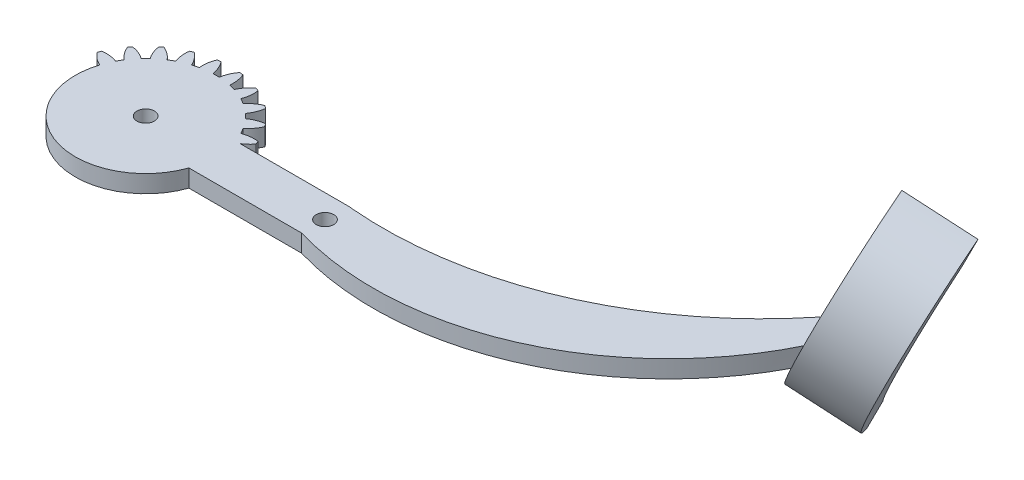
from build123d import *
from build123d.topology import SkipClean

# Parameters (mm, degrees)
SKETCH1_R           = 1.5
BOSS_EXTRUDE1_DEPTH = 3
CUT_EXTRUDE1_START  = -10
CUT_EXTRUDE1_DEPTH  = 10
BOSS_EXTRUDE2_DEPTH = 3
BOSS_EXTRUDE3_START = -25
BOSS_EXTRUDE3_DEPTH = 11
CUT_EXTRUDE2_DEPTH  = 18


with BuildPart() as part:
    # Sketch1 → Boss-Extrude1 (new body)
    with BuildSketch(Plane(origin=(0, 0, 0), x_dir=(1, 0, 0), z_dir=(0, 1, 0))):
        with BuildLine():
            Line((20.643657446, 4), (2.081641936, 4))
            ThreePointArc((2.081641936, 4), (2.861028333, 4.588201733), (3.521749436, 5.30713988))
            ThreePointArc((3.521749436, 5.30713988), (3.405395609, 5.596745198), (3.282888305, 5.883801663))
            ThreePointArc((3.282888305, 5.883801663), (1.93527598, 5.894040025), (0.627094961, 5.57027124))
            ThreePointArc((0.627094961, 5.57027124), (0.366286148, 6.046375), (0.084372603, 6.510293938))
            ThreePointArc((0.084372603, 6.510293938), (1.018855105, 7.48132754), (1.683794586, 8.65351323))
            ThreePointArc((1.683794586, 8.65351323), (1.496450048, 8.903135899), (1.303821399, 9.148703928))
            ThreePointArc((1.303821399, 9.148703928), (-0.000522033, 8.809805691), (-1.180330337, 8.158486898))
            ThreePointArc((-1.180330337, 8.158486898), (-1.555477026, 8.550865528), (-1.947855656, 8.926012217))
            ThreePointArc((-1.947855656, 8.926012217), (-1.296536862, 10.105820521), (-0.957638625, 11.410163953))
            ThreePointArc((-0.957638625, 11.410163953), (-1.203206655, 11.602792602), (-1.452829324, 11.79013714))
            ThreePointArc((-1.452829324, 11.79013714), (-2.625015014, 11.125197659), (-3.596048616, 10.190715157))
            ThreePointArc((-3.596048616, 10.190715157), (-4.059967554, 10.472628702), (-4.536071314, 10.733437515))
            ThreePointArc((-4.536071314, 10.733437515), (-4.212302529, 12.041618533), (-4.222540891, 13.389230859))
            ThreePointArc((-4.222540891, 13.389230859), (-4.509597355, 13.511738163), (-4.799202674, 13.62809199))
            ThreePointArc((-4.799202674, 13.62809199), (-5.759348103, 12.682425791), (-6.455432668, 11.528463019))
            ThreePointArc((-6.455432668, 11.528463019), (-6.976508546, 11.680699536), (-7.503891752, 11.809396783))
            ThreePointArc((-7.503891752, 11.809396783), (-7.529737283, 13.156800143), (-7.888414517, 14.455843809))
            ThreePointArc((-7.888414517, 14.455843809), (-8.197396993, 14.499881098), (-8.507248835, 14.537314892))
            ThreePointArc((-8.507248835, 14.537314892), (-9.18992168, 13.375367565), (-9.563620196, 12.080565177))
            ThreePointArc((-9.563620196, 12.080565177), (-10.106342554, 12.09275), (-10.649064912, 12.080565177))
            ThreePointArc((-10.649064912, 12.080565177), (-11.022763428, 13.375367565), (-11.705436272, 14.537314892))
            ThreePointArc((-11.705436272, 14.537314892), (-12.015288115, 14.499881098), (-12.324270591, 14.455843809))
            ThreePointArc((-12.324270591, 14.455843809), (-12.682947825, 13.156800143), (-12.708793355, 11.809396783))
            ThreePointArc((-12.708793355, 11.809396783), (-13.236176561, 11.680699536), (-13.757252439, 11.528463019))
            ThreePointArc((-13.757252439, 11.528463019), (-14.453337005, 12.682425791), (-15.413482434, 13.62809199))
            ThreePointArc((-15.413482434, 13.62809199), (-15.703087752, 13.511738163), (-15.990144217, 13.389230859))
            ThreePointArc((-15.990144217, 13.389230859), (-16.000382579, 12.041618533), (-15.676613793, 10.733437515))
            ThreePointArc((-15.676613793, 10.733437515), (-16.152717554, 10.472628702), (-16.616636492, 10.190715157))
            ThreePointArc((-16.616636492, 10.190715157), (-17.587670094, 11.125197659), (-18.759855783, 11.79013714))
            ThreePointArc((-18.759855783, 11.79013714), (-19.009478453, 11.602792602), (-19.255046482, 11.410163953))
            ThreePointArc((-19.255046482, 11.410163953), (-18.916148245, 10.105820521), (-18.264829452, 8.926012217))
            ThreePointArc((-18.264829452, 8.926012217), (-18.657208082, 8.550865528), (-19.032354771, 8.158486898))
            ThreePointArc((-19.032354771, 8.158486898), (-20.212163074, 8.809805691), (-21.516506507, 9.148703928))
            ThreePointArc((-21.516506507, 9.148703928), (-21.709135156, 8.903135899), (-21.896479694, 8.65351323))
            ThreePointArc((-21.896479694, 8.65351323), (-21.231540213, 7.48132754), (-20.297057711, 6.510293938))
            ThreePointArc((-20.297057711, 6.510293938), (-20.578971255, 6.046375), (-20.839780068, 5.57027124))
            ThreePointArc((-20.839780068, 5.57027124), (-22.147961087, 5.894040025), (-23.495573413, 5.883801663))
            ThreePointArc((-23.495573413, 5.883801663), (-23.618080717, 5.596745198), (-23.734434544, 5.30713988))
            ThreePointArc((-23.734434544, 5.30713988), (-22.788768345, 4.346994451), (-21.634805572, 3.650909885))
            ThreePointArc((-21.634805572, 3.650909885), (-21.78704209, 3.129834008), (-21.915739337, 2.602450802))
            ThreePointArc((-21.915739337, 2.602450802), (-23.263142697, 2.576605271), (-24.562186363, 2.217928037))
            ThreePointArc((-24.562186363, 2.217928037), (-24.606223651, 1.908945561), (-24.643657446, 1.599093719))
            ThreePointArc((-24.643657446, 1.599093719), (-23.481710119, 0.916420874), (-22.186907731, 0.542722358))
            ThreePointArc((-22.186907731, 0.542722358), (-22.199092554, 0), (-22.186907731, -0.542722358))
            ThreePointArc((-22.186907731, -0.542722358), (-23.481710119, -0.916420874), (-24.643657446, -1.599093719))
            ThreePointArc((-24.643657446, -1.599093719), (-24.606223651, -1.908945561), (-24.562186363, -2.217928037))
            ThreePointArc((-24.562186363, -2.217928037), (-23.263142697, -2.576605271), (-21.915739337, -2.602450802))
            ThreePointArc((-21.915739337, -2.602450802), (-21.78704209, -3.129834008), (-21.634805572, -3.650909885))
            ThreePointArc((-21.634805572, -3.650909885), (-22.788768345, -4.346994451), (-23.734434544, -5.30713988))
            ThreePointArc((-23.734434544, -5.30713988), (-23.618080717, -5.596745198), (-23.495573413, -5.883801663))
            ThreePointArc((-23.495573413, -5.883801663), (-22.147961087, -5.894040025), (-20.839780068, -5.57027124))
            ThreePointArc((-20.839780068, -5.57027124), (-20.578971255, -6.046375), (-20.297057711, -6.510293938))
            ThreePointArc((-20.297057711, -6.510293938), (-21.231540213, -7.48132754), (-21.896479694, -8.65351323))
            ThreePointArc((-21.896479694, -8.65351323), (-21.709135156, -8.903135899), (-21.516506507, -9.148703928))
            ThreePointArc((-21.516506507, -9.148703928), (-20.212163074, -8.809805691), (-19.032354771, -8.158486898))
            ThreePointArc((-19.032354771, -8.158486898), (-18.657208082, -8.550865528), (-18.264829452, -8.926012217))
            ThreePointArc((-18.264829452, -8.926012217), (-18.916148245, -10.105820521), (-19.255046482, -11.410163953))
            ThreePointArc((-19.255046482, -11.410163953), (-19.009478453, -11.602792602), (-18.759855783, -11.79013714))
            ThreePointArc((-18.759855783, -11.79013714), (-17.587670094, -11.125197659), (-16.616636492, -10.190715157))
            ThreePointArc((-16.616636492, -10.190715157), (-16.152717554, -10.472628702), (-15.676613793, -10.733437515))
            ThreePointArc((-15.676613793, -10.733437515), (-16.000382579, -12.041618533), (-15.990144217, -13.389230859))
            ThreePointArc((-15.990144217, -13.389230859), (-15.703087752, -13.511738163), (-15.413482434, -13.62809199))
            ThreePointArc((-15.413482434, -13.62809199), (-14.453337005, -12.682425791), (-13.757252439, -11.528463019))
            ThreePointArc((-13.757252439, -11.528463019), (-13.236176561, -11.680699536), (-12.708793355, -11.809396783))
            ThreePointArc((-12.708793355, -11.809396783), (-12.682947825, -13.156800143), (-12.324270591, -14.455843809))
            ThreePointArc((-12.324270591, -14.455843809), (-12.015288115, -14.499881098), (-11.705436272, -14.537314892))
            ThreePointArc((-11.705436272, -14.537314892), (-11.022763428, -13.375367565), (-10.649064912, -12.080565177))
            ThreePointArc((-10.649064912, -12.080565177), (-10.106342554, -12.09275), (-9.563620196, -12.080565177))
            ThreePointArc((-9.563620196, -12.080565177), (-9.18992168, -13.375367565), (-8.507248835, -14.537314892))
            ThreePointArc((-8.507248835, -14.537314892), (-8.197396993, -14.499881098), (-7.888414517, -14.455843809))
            ThreePointArc((-7.888414517, -14.455843809), (-7.529737283, -13.156800143), (-7.503891752, -11.809396783))
            ThreePointArc((-7.503891752, -11.809396783), (-6.976508546, -11.680699536), (-6.455432668, -11.528463019))
            ThreePointArc((-6.455432668, -11.528463019), (-5.759348103, -12.682425791), (-4.799202674, -13.62809199))
            ThreePointArc((-4.799202674, -13.62809199), (-4.509597355, -13.511738163), (-4.222540891, -13.389230859))
            ThreePointArc((-4.222540891, -13.389230859), (-4.212302529, -12.041618533), (-4.536071314, -10.733437515))
            ThreePointArc((-4.536071314, -10.733437515), (-4.059967554, -10.472628702), (-3.596048616, -10.190715157))
            ThreePointArc((-3.596048616, -10.190715157), (-2.625015014, -11.125197659), (-1.452829324, -11.79013714))
            ThreePointArc((-1.452829324, -11.79013714), (-1.203206655, -11.602792602), (-0.957638625, -11.410163953))
            ThreePointArc((-0.957638625, -11.410163953), (-1.296536862, -10.105820521), (-1.947855656, -8.926012217))
            ThreePointArc((-1.947855656, -8.926012217), (-1.555477026, -8.550865528), (-1.180330337, -8.158486898))
            ThreePointArc((-1.180330337, -8.158486898), (-0.000522033, -8.809805691), (1.303821399, -9.148703928))
            ThreePointArc((1.303821399, -9.148703928), (1.496450048, -8.903135899), (1.683794586, -8.65351323))
            ThreePointArc((1.683794586, -8.65351323), (1.018855105, -7.48132754), (0.084372603, -6.510293938))
            ThreePointArc((0.084372603, -6.510293938), (0.366286148, -6.046375), (0.627094961, -5.57027124))
            ThreePointArc((0.627094961, -5.57027124), (1.93527598, -5.894040025), (3.282888305, -5.883801663))
            ThreePointArc((3.282888305, -5.883801663), (3.405395609, -5.596745198), (3.521749436, -5.30713988))
            ThreePointArc((3.521749436, -5.30713988), (2.861028333, -4.588201733), (2.081641936, -4))
            Line((2.081641936, -4), (20.643657446, -4))
            ThreePointArc((20.643657446, -4), (24.643657446, 0), (20.643657446, 4))
        make_face()
        with Locations((-10.106342554, 0)):
            Circle(SKETCH1_R, mode=Mode.SUBTRACT)
        with Locations((20.643657446, 0)):
            Circle(SKETCH1_R, mode=Mode.SUBTRACT)
    extrude(amount=BOSS_EXTRUDE1_DEPTH)

    # Sketch2 → Cut-Extrude1 (cut)
    with SkipClean():  # the faces are left unmerged after this step: merging them gives an invalid solid
        with BuildSketch(Plane(origin=(0, 3, 0), x_dir=(1, 0, 0), z_dir=(0, 1, 0)).offset(CUT_EXTRUDE1_START)):
            with BuildLine():
                ThreePointArc((3.521749436, -5.30713988), (2.861028333, -4.588201733), (2.081641936, -4))
                Line((2.081641936, -4), (1.305695063, -4))
                ThreePointArc((1.305695063, -4), (0.994195953, -4.797149927), (0.627094961, -5.57027124))
                ThreePointArc((0.627094961, -5.57027124), (1.93527598, -5.894040025), (3.282888305, -5.883801663))
                ThreePointArc((3.282888305, -5.883801663), (3.405395609, -5.596745198), (3.521749436, -5.30713988))
            make_face()
            with BuildLine():
                ThreePointArc((1.683794586, -8.65351323), (1.018855105, -7.48132754), (0.084372603, -6.510293938))
                ThreePointArc((0.084372603, -6.510293938), (-0.512518948, -7.361599771), (-1.180330337, -8.158486898))
                ThreePointArc((-1.180330337, -8.158486898), (-0.000522033, -8.809805691), (1.303821399, -9.148703928))
                ThreePointArc((1.303821399, -9.148703928), (1.496450048, -8.903135899), (1.683794586, -8.65351323))
            make_face()
            with BuildLine():
                ThreePointArc((-0.957638625, -11.410163953), (-1.296536862, -10.105820521), (-1.947855656, -8.926012217))
                ThreePointArc((-1.947855656, -8.926012217), (-2.744742783, -9.593823606), (-3.596048616, -10.190715157))
                ThreePointArc((-3.596048616, -10.190715157), (-2.625015014, -11.125197659), (-1.452829324, -11.79013714))
                ThreePointArc((-1.452829324, -11.79013714), (-1.203206655, -11.602792602), (-0.957638625, -11.410163953))
            make_face()
            with BuildLine():
                ThreePointArc((-4.222540891, -13.389230859), (-4.212302529, -12.041618533), (-4.536071314, -10.733437515))
                ThreePointArc((-4.536071314, -10.733437515), (-5.478647477, -11.172244217), (-6.455432668, -11.528463019))
                ThreePointArc((-6.455432668, -11.528463019), (-5.759348103, -12.682425791), (-4.799202674, -13.62809199))
                ThreePointArc((-4.799202674, -13.62809199), (-4.509597355, -13.511738163), (-4.222540891, -13.389230859))
            make_face()
            with BuildLine():
                ThreePointArc((-7.888414517, -14.455843809), (-7.529737283, -13.156800143), (-7.503891752, -11.809396783))
                ThreePointArc((-7.503891752, -11.809396783), (-8.527921943, -11.989294847), (-9.563620196, -12.080565177))
                ThreePointArc((-9.563620196, -12.080565177), (-9.18992168, -13.375367565), (-8.507248835, -14.537314892))
                ThreePointArc((-8.507248835, -14.537314892), (-8.197396993, -14.499881098), (-7.888414517, -14.455843809))
            make_face()
            with BuildLine():
                ThreePointArc((-11.705436272, -14.537314892), (-11.022763428, -13.375367565), (-10.649064912, -12.080565177))
                ThreePointArc((-10.649064912, -12.080565177), (-11.684763165, -11.989294847), (-12.708793355, -11.809396783))
                ThreePointArc((-12.708793355, -11.809396783), (-12.682947825, -13.156800143), (-12.324270591, -14.455843809))
                ThreePointArc((-12.324270591, -14.455843809), (-12.015288115, -14.499881098), (-11.705436272, -14.537314892))
            make_face()
            with BuildLine():
                ThreePointArc((-15.413482434, -13.62809199), (-14.453337005, -12.682425791), (-13.757252439, -11.528463019))
                ThreePointArc((-13.757252439, -11.528463019), (-14.734037631, -11.172244217), (-15.676613793, -10.733437515))
                ThreePointArc((-15.676613793, -10.733437515), (-16.000382579, -12.041618533), (-15.990144217, -13.389230859))
                ThreePointArc((-15.990144217, -13.389230859), (-15.703087752, -13.511738163), (-15.413482434, -13.62809199))
            make_face()
            with BuildLine():
                ThreePointArc((-18.759855783, -11.79013714), (-17.587670094, -11.125197659), (-16.616636492, -10.190715157))
                ThreePointArc((-16.616636492, -10.190715157), (-17.467942324, -9.593823606), (-18.264829452, -8.926012217))
                ThreePointArc((-18.264829452, -8.926012217), (-18.916148245, -10.105820521), (-19.255046482, -11.410163953))
                ThreePointArc((-19.255046482, -11.410163953), (-19.009478453, -11.602792602), (-18.759855783, -11.79013714))
            make_face()
            with BuildLine():
                ThreePointArc((-21.516506507, -9.148703928), (-20.212163074, -8.809805691), (-19.032354771, -8.158486898))
                ThreePointArc((-19.032354771, -8.158486898), (-19.70016616, -7.361599771), (-20.297057711, -6.510293938))
                ThreePointArc((-20.297057711, -6.510293938), (-21.231540213, -7.48132754), (-21.896479694, -8.65351323))
                ThreePointArc((-21.896479694, -8.65351323), (-21.709135156, -8.903135899), (-21.516506507, -9.148703928))
            make_face()
            with BuildLine():
                ThreePointArc((-23.495573413, -5.883801663), (-22.147961087, -5.894040025), (-20.839780068, -5.57027124))
                ThreePointArc((-20.839780068, -5.57027124), (-21.278586771, -4.627695077), (-21.634805572, -3.650909885))
                ThreePointArc((-21.634805572, -3.650909885), (-22.788768345, -4.346994451), (-23.734434544, -5.30713988))
                ThreePointArc((-23.734434544, -5.30713988), (-23.618080717, -5.596745198), (-23.495573413, -5.883801663))
            make_face()
            with BuildLine():
                ThreePointArc((-24.562186363, -2.217928037), (-23.263142697, -2.576605271), (-21.915739337, -2.602450802))
                ThreePointArc((-21.915739337, -2.602450802), (-22.095637401, -1.578420611), (-22.186907731, -0.542722358))
                ThreePointArc((-22.186907731, -0.542722358), (-23.481710119, -0.916420874), (-24.643657446, -1.599093719))
                ThreePointArc((-24.643657446, -1.599093719), (-24.606223651, -1.908945561), (-24.562186363, -2.217928037))
            make_face()
            with BuildLine():
                ThreePointArc((-22.186907731, 0.542722358), (-22.095637401, 1.578420611), (-21.915739337, 2.602450802))
                ThreePointArc((-21.915739337, 2.602450802), (-23.263142697, 2.576605271), (-24.562186363, 2.217928037))
                ThreePointArc((-24.562186363, 2.217928037), (-24.606223651, 1.908945561), (-24.643657446, 1.599093719))
                ThreePointArc((-24.643657446, 1.599093719), (-23.481710119, 0.916420874), (-22.186907731, 0.542722358))
            make_face()
        extrude(amount=CUT_EXTRUDE1_DEPTH, mode=Mode.SUBTRACT)

    # Sketch3 → Boss-Extrude2 (add)
    with SkipClean():  # the faces are left unmerged after this step: merging them gives an invalid solid
        with BuildSketch(Plane(origin=(0, 0, 0), x_dir=(-1, 0, 0), z_dir=(0, -1, 0))):
            with BuildLine():
                Line((-79.256129558, 30.184422326), (-84.5347622, 34.134758187))
                ThreePointArc((-84.5347622, 34.134758187), (-60.921194782, 1.107942896), (-20.643657446, -4))
                ThreePointArc((-20.643657446, -4), (-24.627079637, -0.363796164), (-21.368234303, 3.933826175))
                ThreePointArc((-21.368234303, 3.933826175), (-53.742117956, 9.495418793), (-79.256129558, 30.184422326))
            make_face()
        extrude(amount=-BOSS_EXTRUDE2_DEPTH)

    # Sketch6 → Boss-Extrude3 (add)
    with SkipClean():  # the faces are left unmerged after this step: merging them gives an invalid solid
        with BuildSketch(Plane(origin=(83.697305175, -41.228426748, -34.520544843), x_dir=(-0.31128571654952064, 0.15333612397060284, -0.9378641883332167), z_dir=(0.8413302222587926, -0.41443056459664523, -0.34700254212624526)).offset(BOSS_EXTRUDE3_START)):
            with BuildLine():
                Line((5.839272949, 55.835320297), (6.70860934, 60.75916577))
                ThreePointArc((6.70860934, 60.75916577), (-7.758054939, 45.542684524), (0.623254605, 26.29224746))
                Line((0.623254605, 26.29224746), (1.492590996, 31.216092933))
                ThreePointArc((1.492590996, 31.216092933), (-1.305346039, 44.403417523), (5.839272949, 55.835320297))
            make_face()
        extrude(amount=BOSS_EXTRUDE3_DEPTH)

    # Sketch7 → Cut-Extrude2 (cut)
    with SkipClean():  # the faces are left unmerged after this step: merging them gives an invalid solid
        with BuildSketch(Plane(origin=(71.918682063, -35.426398843, -29.662509253), x_dir=(-0.3112857165495207, 0.15333612397060292, -0.9378641883332167), z_dir=(0.8413302222587925, -0.4144305645966453, -0.3470025421262454))):
            Polygon((5.839272949, 55.835320297), (1.492590996, 31.216092933), (5.421636876, 30.152678835), (10.120128915, 55.079507813), align=None)
        extrude(amount=-CUT_EXTRUDE2_DEPTH, mode=Mode.SUBTRACT)


solid = part.part
